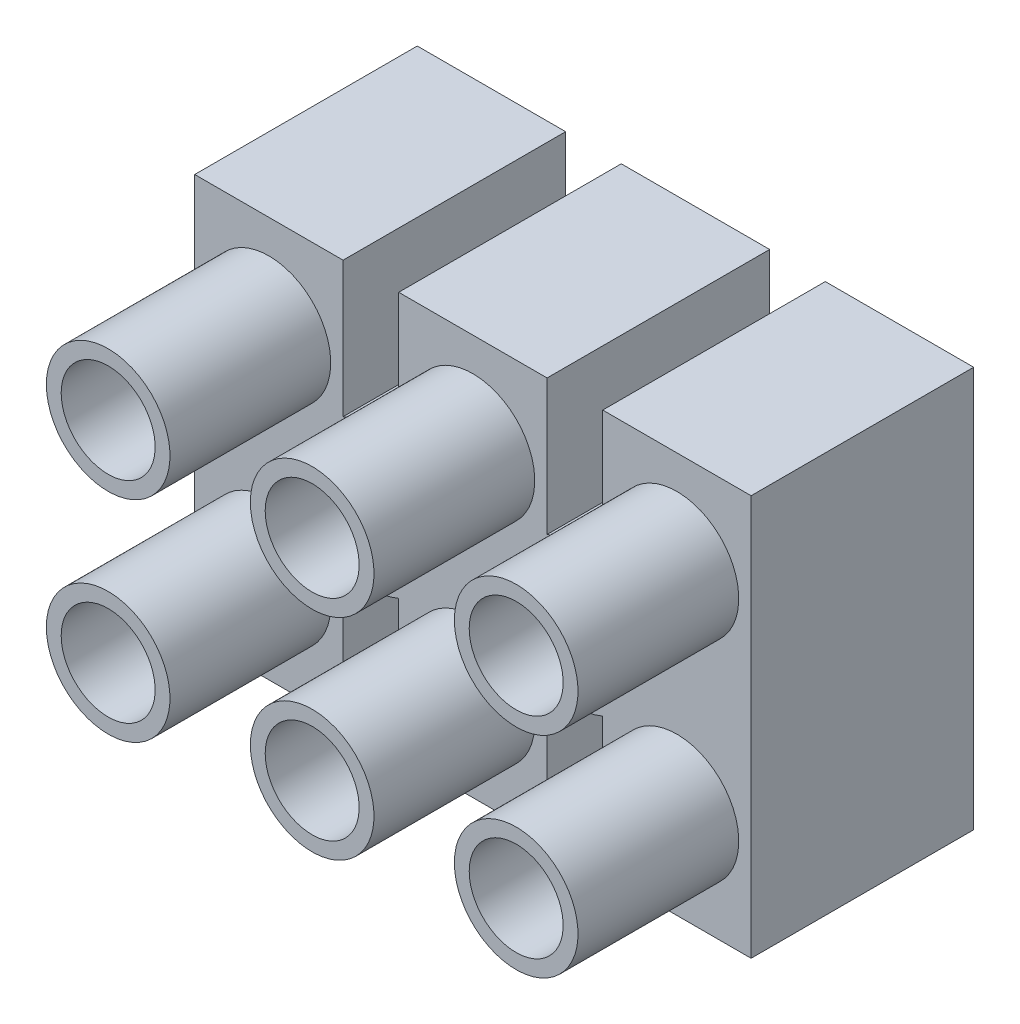
from build123d import *

# Parameters (mm, degrees)
SKETCH1_R               = 1.35
BOSS_EXTRUDE1_DEPTH     = 9
SKETCH2_R               = 2.5
SKETCH2_R_2             = 1.9
BOSS_EXTRUDE2_DEPTH     = 6.5
CRVPATTERN1_START       = 9
CRVPATTERN1_OUTLINE_R   = 2.5
CRVPATTERN1_OUTLINE_R_2 = 1.9
CRVPATTERN1_DEPTH       = 6.5


# Read off the part's stored shape, not the designer's step: CrvPattern1
with BuildPart() as part:
    # Sketch1 → Boss-Extrude1 (new body)
    with BuildSketch(Plane.XY):
        with BuildLine():
            Line((11.25, 8.1), (11.25, -8.1))
            Line((11.25, -8.1), (5.25, -8.1))
            Line((5.25, -8.1), (5.25, -2.618563538))
            ThreePointArc((5.25, -2.618563538), (4.125, -2.85), (3, -2.618563538))
            Line((3, -2.618563538), (3, -8.1))
            Line((3, -8.1), (-3, -8.1))
            Line((-3, -8.1), (-3, -2.618563538))
            ThreePointArc((-3, -2.618563538), (-4.125, -2.85), (-5.25, -2.618563538))
            Line((-5.25, -2.618563538), (-5.25, -8.1))
            Line((-5.25, -8.1), (-11.25, -8.1))
            Line((-11.25, -8.1), (-11.25, 8.1))
            Line((-11.25, 8.1), (-5.25, 8.1))
            Line((-5.25, 8.1), (-5.25, 2.618563538))
            ThreePointArc((-5.25, 2.618563538), (-4.125, 2.85), (-3, 2.618563538))
            Line((-3, 2.618563538), (-3, 8.1))
            Line((-3, 8.1), (3, 8.1))
            Line((3, 8.1), (3, 2.618563538))
            ThreePointArc((3, 2.618563538), (4.125, 2.85), (5.25, 2.618563538))
            Line((5.25, 2.618563538), (5.25, 8.1))
            Line((5.25, 8.1), (11.25, 8.1))
        make_face()
        with Locations((-4.125, 0)):
            Circle(SKETCH1_R, mode=Mode.SUBTRACT)
        with Locations((4.125, 0)):
            Circle(SKETCH1_R, mode=Mode.SUBTRACT)
    extrude(amount=BOSS_EXTRUDE1_DEPTH)

    # Sketch2 → Boss-Extrude2 (add)
    with BuildSketch(Plane.XY.offset(9)):
        with Locations(Location((0, 4.25, 0), (0, 0, 180))):
            Circle(SKETCH2_R)
        with Locations(Location((0, 4.25, 0), (0, 0, 180))):
            Circle(SKETCH2_R_2, mode=Mode.SUBTRACT)
    boss_extrude2 = extrude(amount=BOSS_EXTRUDE2_DEPTH)

    # CrvPattern1 outline → CrvPattern1 (add)
    # profile 1 of 2: a face of its own
    with BuildSketch(Plane.XY.offset(CRVPATTERN1_START)):
        with Locations((8.25, 4.25)):
            Circle(CRVPATTERN1_OUTLINE_R)
        with Locations((8.25, 4.25)):
            Circle(CRVPATTERN1_OUTLINE_R_2, mode=Mode.SUBTRACT)
    # profile 2 of 2: a face of its own
    with BuildSketch(Plane.XY.offset(CRVPATTERN1_START)):
        with Locations((-8.25, 4.25)):
            Circle(CRVPATTERN1_OUTLINE_R)
        with Locations((-8.25, 4.25)):
            Circle(CRVPATTERN1_OUTLINE_R_2, mode=Mode.SUBTRACT)
    crvpattern1 = extrude(amount=CRVPATTERN1_DEPTH)

    # Mirror1: Boss-Extrude2, CrvPattern1 across plane
    add(boss_extrude2.mirror(Plane.ZX))
    add(crvpattern1.mirror(Plane.ZX))


solid = part.part
